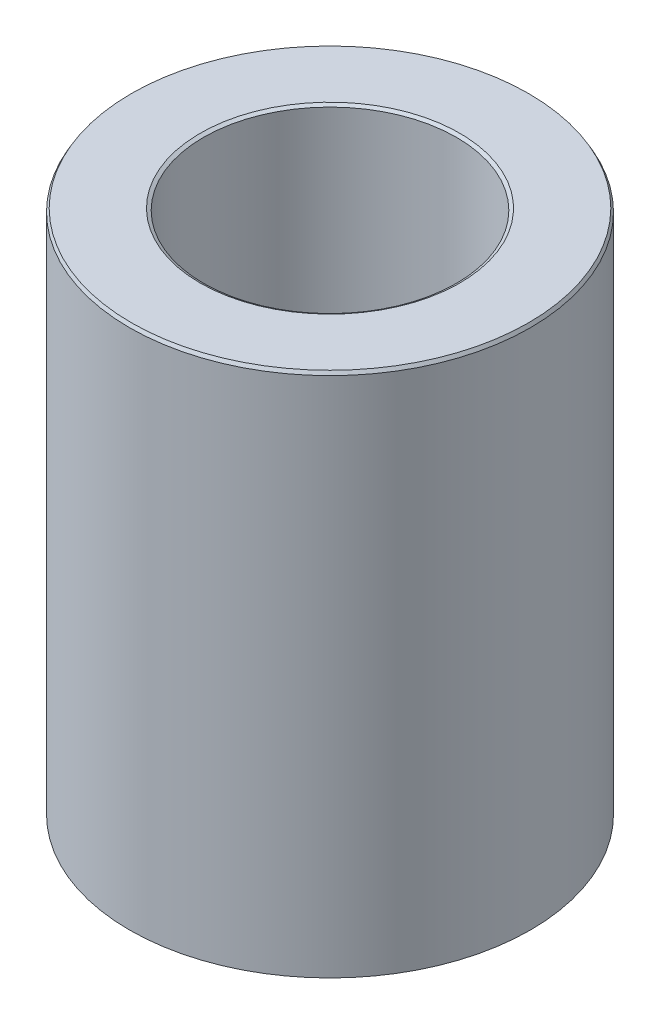
from build123d import *
from OCP.BRepFilletAPI import BRepFilletAPI_MakeChamfer

# Parameters (mm, degrees)
SKETCH1_R           = 15
BOSS_EXTRUDE1_DEPTH = 39.42173187
SKETCH2_R           = 9.463711318
CUT_EXTRUDE1_DEPTH  = 45.766873284
CHAMFER1_SIZE       = 0.247921717
CHAMFER1_SIZE2      = 0.141312825


with BuildPart() as part:
    # Sketch1 → Boss-Extrude1 (new body)
    with BuildSketch(Plane(origin=(0, 0, 0), x_dir=(1, 0, 0), z_dir=(0, 1, 0))):
        Circle(SKETCH1_R)
    extrude(amount=BOSS_EXTRUDE1_DEPTH)

    # Sketch2 → Cut-Extrude1 (cut, through all)
    with BuildSketch(Plane(origin=(0, 0, 0), x_dir=(1, 0, 0), z_dir=(0, 1, 0))):
        Circle(SKETCH2_R)
    extrude(amount=CUT_EXTRUDE1_DEPTH, mode=Mode.SUBTRACT)

    # Chamfer1: one chamfer whose edges measure the first distance from different faces: ONE call of the kernel's chamfer builder (chamfer() names one face for all edges)
    chamfer1_edges_1 = [part.edges().sort_by_distance(p)[0] for p in [
        (-9.463711318, 39.42173187, 0),
    ]]
    chamfer1_side_1 = [part.faces().sort_by_distance(p)[0] for p in [
        (-14.575735931, 39.42173187, 0),
    ]]
    chamfer1_edges_2 = [part.edges().sort_by_distance(p)[0] for p in [
        (-9.463711318, 0, 0),
    ]]
    chamfer1_side_2 = [part.faces().sort_by_distance(p)[0] for p in [
        (-9.463711318, 19.710865935, 0),
    ]]
    chamfer1_edges_3 = [part.edges().sort_by_distance(p)[0] for p in [
        (-15, 0, 0),
    ]]
    chamfer1_side_3 = [part.faces().sort_by_distance(p)[0] for p in [
        (-14.575735931, 0, 0),
    ]]
    chamfer1_edges_4 = [part.edges().sort_by_distance(p)[0] for p in [
        (-15, 39.42173187, 0),
    ]]
    chamfer1_side_4 = [part.faces().sort_by_distance(p)[0] for p in [
        (-15, 19.710865935, 0),
    ]]
    chamfer1 = BRepFilletAPI_MakeChamfer(part.part.solid().wrapped)
    for e in chamfer1_edges_1:
        chamfer1.Add(CHAMFER1_SIZE, CHAMFER1_SIZE2, e.wrapped, chamfer1_side_1[0].wrapped)  # the first distance lies on this face
    for e in chamfer1_edges_2:
        chamfer1.Add(CHAMFER1_SIZE, CHAMFER1_SIZE2, e.wrapped, chamfer1_side_2[0].wrapped)  # the first distance lies on this face
    for e in chamfer1_edges_3:
        chamfer1.Add(CHAMFER1_SIZE, CHAMFER1_SIZE2, e.wrapped, chamfer1_side_3[0].wrapped)  # the first distance lies on this face
    for e in chamfer1_edges_4:
        chamfer1.Add(CHAMFER1_SIZE, CHAMFER1_SIZE2, e.wrapped, chamfer1_side_4[0].wrapped)  # the first distance lies on this face
    add(Compound.cast(chamfer1.Shape()), mode=Mode.REPLACE)


solid = part.part
